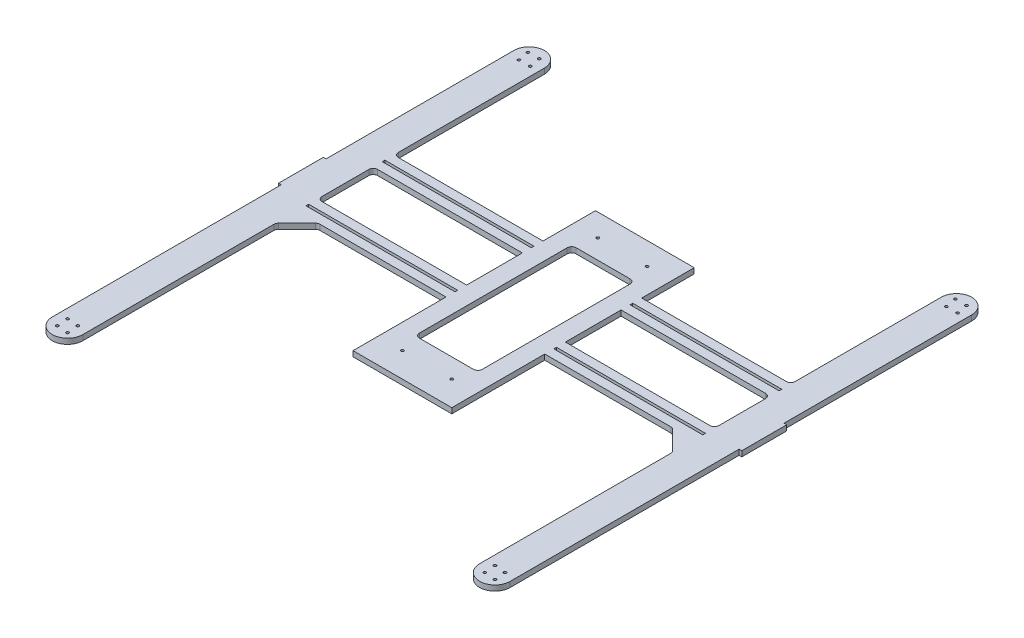
from build123d import *

# Parameters (mm, degrees)
SKETCH1_R           = 1.5
SKETCH1_W           = 166
SKETCH1_H           = 3
SKETCH1_H_2         = 62
SKETCH1_W_2         = 70
SKETCH1_H_3         = 174.5
BOSS_EXTRUDE1_DEPTH = 6
FILLET_1_R          = 5


with BuildPart() as part:
    # Sketch1 → Boss-Extrude1 (new body)
    with BuildSketch(Plane(origin=(0, 0, 0), x_dir=(1, 0, 0), z_dir=(0, 1, 0))):
        with BuildLine():
            Line((192.5, -16.5), (216, -40))
            Line((216, -40), (216, -255))
            ThreePointArc((216, -255), (233, -272), (250, -255))
            Line((250, -255), (250, 0))
            Line((250, 0), (253, 0))
            Line((253, 0), (253, 50))
            Line((253, 50), (250, 50))
            Line((250, 50), (250, 259.060301809))
            ThreePointArc((250, 259.060301809), (233, 276.060301809), (216, 259.060301809))
            Line((216, 259.060301809), (216, 91.5))
            Line((216, 91.5), (50, 91.5))
            Line((50, 91.5), (50, 150))
            Line((50, 150), (-60, 150))
            Line((-60, 150), (-60, 91.5))
            Line((-60, 91.5), (-226, 91.5))
            Line((-226, 91.5), (-226, 259.060301809))
            ThreePointArc((-226, 259.060301809), (-243, 276.060301809), (-260, 259.060301809))
            Line((-260, 259.060301809), (-260, 50))
            Line((-260, 50), (-263, 50))
            Line((-263, 50), (-263, 0))
            Line((-263, 0), (-260, 0))
            Line((-260, 0), (-260, -255))
            ThreePointArc((-260, -255), (-243, -272), (-226, -255))
            Line((-226, -255), (-226, -40))
            Line((-226, -40), (-202.5, -16.5))
            Line((-202.5, -16.5), (-60, -16.5))
            Line((-60, -16.5), (-60, -120))
            Line((-60, -120), (50, -120))
            Line((50, -120), (50, -16.5))
            Line((50, -16.5), (192.5, -16.5))
        make_face()
        with Locations((-248.656854249, -260.656854249)):
            Circle(SKETCH1_R, mode=Mode.SUBTRACT)
        with Locations((-236.282485579, -261.717514421)):
            Circle(SKETCH1_R, mode=Mode.SUBTRACT)
        with Locations((-249.717514421, -248.282485579)):
            Circle(SKETCH1_R, mode=Mode.SUBTRACT)
        with Locations((-237.343145751, -249.343145751)):
            Circle(SKETCH1_R, mode=Mode.SUBTRACT)
        with Locations((-143, -5)):
            Rectangle(SKETCH1_W, SKETCH1_H, mode=Mode.SUBTRACT)
        with Locations((-32.5, -92.5)):
            Circle(SKETCH1_R, mode=Mode.SUBTRACT)
        with Locations((227.343145751, -260.656854249)):
            Circle(SKETCH1_R, mode=Mode.SUBTRACT)
        with Locations((239.717514421, -261.717514421)):
            Circle(SKETCH1_R, mode=Mode.SUBTRACT)
        with Locations((226.282485579, -248.282485579)):
            Circle(SKETCH1_R, mode=Mode.SUBTRACT)
        with Locations((238.656854249, -249.343145751)):
            Circle(SKETCH1_R, mode=Mode.SUBTRACT)
        with Locations((22.5, -92.5)):
            Circle(SKETCH1_R, mode=Mode.SUBTRACT)
        with Locations((133, -5)):
            Rectangle(SKETCH1_W, SKETCH1_H, mode=Mode.SUBTRACT)
        with Locations((-143, 37.5)):
            Rectangle(SKETCH1_W, SKETCH1_H_2, mode=Mode.SUBTRACT)
        with Locations((-143, 80)):
            Rectangle(SKETCH1_W, SKETCH1_H, mode=Mode.SUBTRACT)
        with Locations((-32.5, 125)):
            Circle(SKETCH1_R, mode=Mode.SUBTRACT)
        with Locations((-248.092169369, 252.890227975)):
            Circle(SKETCH1_R, mode=Mode.SUBTRACT)
        with Locations((-235.673037322, 253.013350683)):
            Circle(SKETCH1_R, mode=Mode.SUBTRACT)
        with Locations((-250.326962678, 265.107252935)):
            Circle(SKETCH1_R, mode=Mode.SUBTRACT)
        with Locations((-237.907830631, 265.230375643)):
            Circle(SKETCH1_R, mode=Mode.SUBTRACT)
        with Locations((-5, 16.25)):
            Rectangle(SKETCH1_W_2, SKETCH1_H_3, mode=Mode.SUBTRACT)
        with Locations((22.5, 125)):
            Circle(SKETCH1_R, mode=Mode.SUBTRACT)
        with Locations((133, 37.5)):
            Rectangle(SKETCH1_W, SKETCH1_H_2, mode=Mode.SUBTRACT)
        with Locations((133, 80)):
            Rectangle(SKETCH1_W, SKETCH1_H, mode=Mode.SUBTRACT)
        with Locations((227.907830631, 252.890227975)):
            Circle(SKETCH1_R, mode=Mode.SUBTRACT)
        with Locations((240.326962678, 253.013350683)):
            Circle(SKETCH1_R, mode=Mode.SUBTRACT)
        with Locations((225.673037322, 265.107252935)):
            Circle(SKETCH1_R, mode=Mode.SUBTRACT)
        with Locations((238.092169369, 265.230375643)):
            Circle(SKETCH1_R, mode=Mode.SUBTRACT)
    extrude(amount=BOSS_EXTRUDE1_DEPTH)

    # Скругление1
    fillet_1_edges = [part.edges().sort_by_distance(p)[0] for p in [
        (216, 3, -6.5),
        (216, 3, -68.5),
        (216, 3, -91.5),
        (-226, 3, -6.5),
        (-226, 3, -68.5),
        (-226, 3, -91.5),
        (-226, 3, 40),
        (-202.5, 3, 16.5),
        (216, 3, 40),
        (192.5, 3, 16.5),
        (-40, 3, 71),
        (30, 3, 71),
        (30, 3, -103.5),
        (-40, 3, -103.5),
    ]]
    fillet(fillet_1_edges, radius=FILLET_1_R)


solid = part.part
